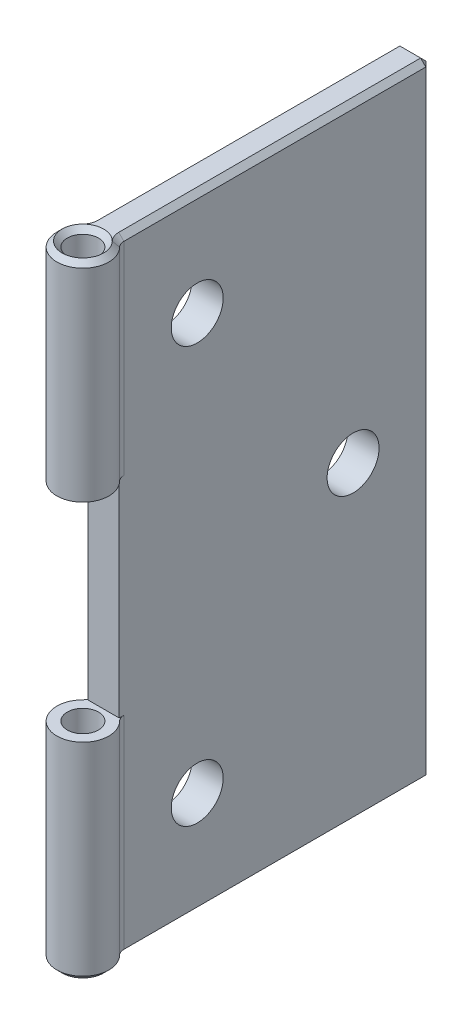
from build123d import *

# Parameters (mm, degrees)
SKETCH1_W           = 30
SKETCH1_H           = 60
SKETCH1_R           = 2.5
BOSS_EXTRUDE1_DEPTH = 1.5
SKETCH3_R           = 1.5
BOSS_EXTRUDE2_DEPTH = 20
FILLET1_R           = 1
CHAMFER1_SIZE       = 0.5


with BuildPart() as part:
    # Sketch1 → Boss-Extrude1 (new, symmetric)
    with BuildSketch(Plane(origin=(0, 0, 0), x_dir=(0, 0, -1), z_dir=(1, 0, 0))):
        Rectangle(SKETCH1_W, SKETCH1_H)
        with Locations((-7.5, 20)):
            Circle(SKETCH1_R, mode=Mode.SUBTRACT)
        with Locations((7.5, 0)):
            Circle(SKETCH1_R, mode=Mode.SUBTRACT)
        with Locations((-7.5, -20)):
            Circle(SKETCH1_R, mode=Mode.SUBTRACT)
    extrude(amount=BOSS_EXTRUDE1_DEPTH, both=True)

    # Sketch3 → Boss-Extrude2 (add)
    with BuildSketch(Plane(origin=(0, 30, 0), x_dir=(1, 0, 0), z_dir=(0, 1, 0))):
        with BuildLine():
            Line((-1.5, -15), (1.5, -15))
            ThreePointArc((1.5, -15), (0, -19.5), (-1.5, -15))
        make_face()
        with Locations(Location((0, -17, 0), (0, 0, 270))):
            Circle(SKETCH3_R, mode=Mode.SUBTRACT)
    boss_extrude2 = extrude(amount=-BOSS_EXTRUDE2_DEPTH)

    # Mirror1: Boss-Extrude2 across plane
    add(boss_extrude2.mirror(Plane.ZX))

    # Fillet1
    fillet1_edges = [part.edges().sort_by_distance(p)[0] for p in [
        (-1.5, -20, 15),
        (1.5, -20, 15),
        (1.5, 20, 15),
        (-1.5, 20, 15),
    ]]
    fillet(fillet1_edges, radius=FILLET1_R)

    # Chamfer1
    chamfer1_edges = [part.edges().sort_by_distance(p)[0] for p in [
        (1.5, 0, -15),
        (1.5, 30, -0.224744871),
        (0, 30, 15.5),
        (0, -30, 15.5),
        (-1.5, 30, -0.224744871),
        (0, -30, 19.5),
        (-1.5, 0, -15),
        (-1.5, -30, -0.224744871),
        (0, 30, 19.5),
        (1.5, -30, -0.224744871),
        (-1.5741799, -30, 14.92847473),
        (-1.5741799, 30, 14.92847473),
        (1.5741799, -30, 14.92847473),
        (1.5741799, 30, 14.92847473),
        (0, 30, -15),
        (0, -30, -15),
    ]]
    chamfer(chamfer1_edges, length=CHAMFER1_SIZE - 0.0001)  # a hair under: the kernel refuses the full size


solid = part.part
